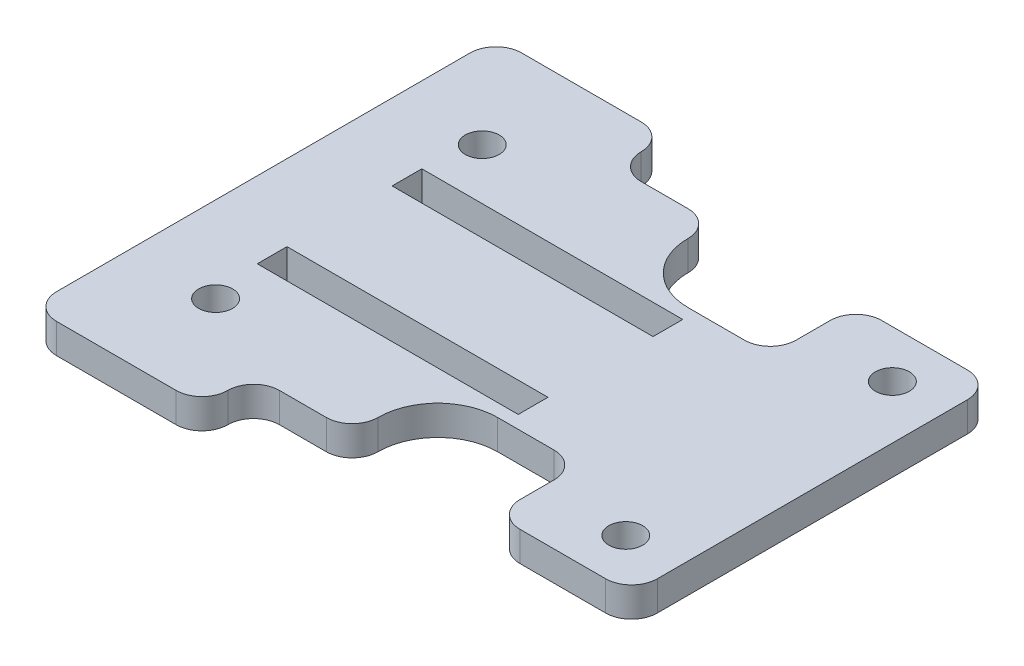
from build123d import *

# Parameters (mm, degrees)
EXTRUDE_1_DEPTH     = 4.6
SKETCH_1_R          = 2.625
SKETCH_1_W          = 40.4
SKETCH_1_H          = 4.6
CUT_EXTRUDE_1_DEPTH = 4.6
FILLET_2_R          = 4
FILLET_3_R          = 9.2625


with BuildPart() as part:
    # 草图3 → 凸台-拉伸1 (new body)
    with BuildSketch(Plane(origin=(0, 0, 0), x_dir=(1, 0, 0), z_dir=(0, 1, 0))):
        Polygon((-18.5, -28), (40, -28), (40, 28), (-18.5, 28), (-18.5, 36), (-45, 36), (-45, 28), (-45, -28), (-45, -36), (-18.5, -36), align=None)
    extrude(amount=EXTRUDE_1_DEPTH)

    # 草图1 → 切除-拉伸1 (cut)
    with BuildSketch(Plane(origin=(0, 0, 0), x_dir=(1, 0, 0), z_dir=(0, 1, 0))):
        with Locations(Location((-31.75, 20.6375, 0), (0, 0, 90))):
            Circle(SKETCH_1_R)
        with Locations(Location((31.75, 20.6375, 0), (0, 0, 90))):
            Circle(SKETCH_1_R)
        with Locations(Location((31.75, -20.6375, 0), (0, 0, 90))):
            Circle(SKETCH_1_R)
        with Locations(Location((-31.75, -20.6375, 0), (0, 0, 90))):
            Circle(SKETCH_1_R)
        with Locations((-13, -10.4375)):
            Rectangle(SKETCH_1_W, SKETCH_1_H)
        with Locations((-13, 10.4375)):
            Rectangle(SKETCH_1_W, SKETCH_1_H)
        Polygon((-3.25, -26.5375), (-3.25, -14.7375), (18.75, -14.7375), (18.75, -26.5375), (18.75, -29.869530405), (-3.25, -29.869530405), align=None)
        Polygon((-3.25, 14.7375), (18.75, 14.7375), (18.75, 26.5375), (18.75, 29.869530405), (-3.25, 29.869530405), (-3.25, 26.5375), align=None)
    extrude(amount=CUT_EXTRUDE_1_DEPTH, mode=Mode.SUBTRACT)

    # 圆角2
    fillet_2_edges = [part.edges().sort_by_distance(p)[0] for p in [
        (-3.25, 2.3, -28),
        (18.75, 2.3, -28),
        (40, 2.3, -28),
        (40, 2.3, 28),
        (18.75, 2.3, 28),
        (-3.25, 2.3, 28),
        (18.75, 2.3, -14.7375),
        (18.75, 2.3, 14.7375),
        (-18.5, 2.3, 28),
        (-18.5, 2.3, 36),
        (-45, 2.3, 36),
        (-45, 2.3, -36),
        (-18.5, 2.3, -36),
        (-18.5, 2.3, -28),
    ]]
    fillet(fillet_2_edges, radius=FILLET_2_R - 0.0001)  # a hair under: the kernel refuses the full size

    # 圆角3
    fillet_3_edges = [part.edges().sort_by_distance(p)[0] for p in [
        (-3.25, 2.3, -14.7375),
        (-3.25, 2.3, 14.7375),
    ]]
    fillet(fillet_3_edges, radius=FILLET_3_R)


solid = part.part
